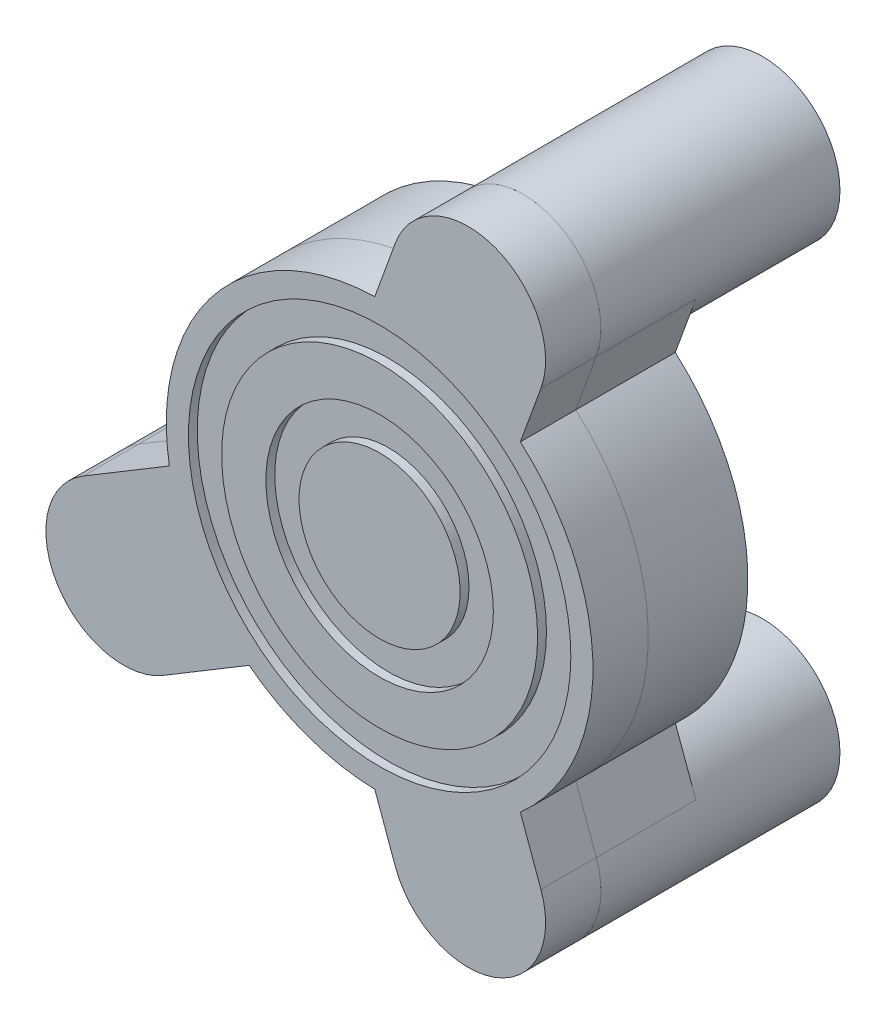
from build123d import *

# Parameters (mm, degrees)
SKETCH1_R             = 9.639410298
SKETCH1_W             = 11
SKETCH1_H             = 12
BOSS_EXTRUDE1_DEPTH   = 2.5
BOSS_EXTRUDE2_START   = 2
SKETCH2_R             = 9.639410298
SKETCH2_W             = 11
SKETCH2_H             = 12
SKETCH2_W_2           = 2.7
SKETCH2_H_2           = 11
BOSS_EXTRUDE2_DEPTH   = 2
SKETCH3_R             = 1
BOSS_EXTRUDE3_DEPTH   = 4.5
SKETCH4_R             = 1
BOSS_EXTRUDE4_DEPTH   = 6.3
SKETCH5_W             = 4
SKETCH5_H             = 2
BOSS_EXTRUDE5_DEPTH   = 1.5
FILLET1_R             = 1.5
SKETCH6_R             = 2.05
CUT_EXTRUDE1_DEPTH    = 6.8
SKETCH7_R             = 1
BOSS_EXTRUDE6_DEPTH   = 0.2
CUT_EXTRUDE2_DEPTH    = 1
FILLET2_R             = 1
FILLET3_R             = 1
SKETCH9_R             = 2.05
BOSS_EXTRUDE7_DEPTH   = 1.5
BOSS_EXTRUDE8_START   = 1
BOSS_EXTRUDE8_DEPTH   = 1
SKETCH11_R            = 1.8
BOSS_EXTRUDE9_DEPTH   = 2
BOSS_EXTRUDE9_2_DEPTH = 2
BOSS_EXTRUDE9_3_DEPTH = 2
CHAMFER1_SIZE         = 0.8
SKETCH12_R            = 8.639410298
SKETCH12_R_2          = 7.139410298
SKETCH12_R_3          = 5.139410298
SKETCH12_R_4          = 3.639410298
CUT_EXTRUDE3_DEPTH    = 0.4


with BuildPart() as part:
    # Sketch1 → Boss-Extrude1 (new body)
    with BuildSketch(Plane.XY):
        Circle(SKETCH1_R)
        Rectangle(SKETCH1_W, SKETCH1_H, mode=Mode.SUBTRACT)
    extrude(amount=-BOSS_EXTRUDE1_DEPTH)

    # Sketch2 → Boss-Extrude2 (add)
    # profile 1 of 2: a face of its own
    with BuildSketch(Plane.XY.offset(BOSS_EXTRUDE2_START)):
        Circle(SKETCH2_R)
        Rectangle(SKETCH2_W, SKETCH2_H, mode=Mode.SUBTRACT)
    # profile 2 of 2: a face of its own
    with BuildSketch(Plane.XY.offset(BOSS_EXTRUDE2_START)):
        Rectangle(SKETCH2_W, SKETCH2_H)
        with Locations((3.81, 0)):
            Rectangle(SKETCH2_W_2, SKETCH2_H_2, mode=Mode.SUBTRACT)
        with Locations((-3.81, 0)):
            Rectangle(SKETCH2_W_2, SKETCH2_H_2, mode=Mode.SUBTRACT)
    extrude(amount=-BOSS_EXTRUDE2_DEPTH)

    # Sketch3 → Boss-Extrude3 (add)
    # profile 1 of 3: a face of its own
    with BuildSketch(Plane.XY.offset(2)):
        with BuildLine():
            Line((-9.501068119, -1.627247829), (-13.381703586, -3.959799129))
            ThreePointArc((-13.381703586, -3.959799129), (-14.578400953, -8.762706104), (-9.775493977, -9.959403471))
            Line((-9.775493977, -9.959403471), (-5.89485851, -7.626852171))
            ThreePointArc((-5.89485851, -7.626852171), (-8.26180684, -4.965962005), (-9.501068119, -1.627247829))
        make_face()
        with Locations((-11.578598782, -6.9596013)):
            Circle(SKETCH3_R, mode=Mode.SUBTRACT)
    # profile 2 of 3: a face of its own
    with BuildSketch(Plane.XY.offset(2)):
        with BuildLine():
            Line((0.710723018, 12.196100721), (-0.219894755, 9.636901846))
            ThreePointArc((-0.219894755, 9.636901846), (3.294201602, 9.059054404), (6.35865921, 7.244700404))
            Line((6.35865921, 7.244700404), (7.289276982, 9.803899279))
            ThreePointArc((7.289276982, 9.803899279), (5.196100721, 14.289276982), (0.710723018, 12.196100721))
        make_face()
        with Locations((4, 11)):
            Circle(SKETCH3_R, mode=Mode.SUBTRACT)
    # profile 3 of 3: a face of its own
    with BuildSketch(Plane.XY.offset(2)):
        with BuildLine():
            Line((-0.219894755, -9.636901846), (0.710723018, -12.196100721))
            ThreePointArc((0.710723018, -12.196100721), (5.196100721, -14.289276982), (7.289276982, -9.803899279))
            Line((7.289276982, -9.803899279), (6.35865921, -7.244700404))
            ThreePointArc((6.35865921, -7.244700404), (3.294201602, -9.059054404), (-0.219894755, -9.636901846))
        make_face()
        with Locations((4, -11)):
            Circle(SKETCH3_R, mode=Mode.SUBTRACT)
    extrude(amount=-BOSS_EXTRUDE3_DEPTH)

    # Sketch4 → Boss-Extrude4 (add)
    # profile 1 of 3: a face of its own
    with BuildSketch(Plane(origin=(0, 0, -2.5), x_dir=(-1, 0, 0), z_dir=(0, 0, -1))):
        with BuildLine():
            ThreePointArc((13.381703586, -3.959799129), (8.578796611, -5.156496496), (9.775493977, -9.959403471))
            ThreePointArc((9.775493977, -9.959403471), (13.301841827, -10.005981678), (15.078598782, -6.9596013))
            ThreePointArc((15.078598782, -6.9596013), (14.62497916, -5.236358255), (13.381703586, -3.959799129))
        make_face()
        with Locations(Location((11.578598782, -6.9596013, 0), (0, 0, 180))):
            Circle(SKETCH4_R, mode=Mode.SUBTRACT)
    # profile 2 of 3: a face of its own
    with BuildSketch(Plane(origin=(0, 0, -2.5), x_dir=(-1, 0, 0), z_dir=(0, 0, -1))):
        with BuildLine():
            ThreePointArc((-7.289276982, -9.803899279), (-5.196100721, -14.289276982), (-0.710723018, -12.196100721))
            ThreePointArc((-0.710723018, -12.196100721), (-0.553083303, -11.607260472), (-0.5, -11))
            ThreePointArc((-0.5, -11), (-3.392739528, -7.553083303), (-7.289276982, -9.803899279))
        make_face()
        with Locations(Location((-4, -11, 0), (0, 0, 180))):
            Circle(SKETCH4_R, mode=Mode.SUBTRACT)
    # profile 3 of 3: a face of its own
    with BuildSketch(Plane(origin=(0, 0, -2.5), x_dir=(-1, 0, 0), z_dir=(0, 0, -1))):
        with BuildLine():
            ThreePointArc((-0.5, 11), (-0.553083303, 11.607260472), (-0.710723018, 12.196100721))
            ThreePointArc((-0.710723018, 12.196100721), (-5.196100721, 14.289276982), (-7.289276982, 9.803899279))
            ThreePointArc((-7.289276982, 9.803899279), (-3.392739528, 7.553083303), (-0.5, 11))
        make_face()
        with Locations(Location((-4, 11, 0), (0, 0, 180))):
            Circle(SKETCH4_R, mode=Mode.SUBTRACT)
    extrude(amount=BOSS_EXTRUDE4_DEPTH)

    # Sketch5 → Boss-Extrude5 (add)
    with BuildSketch(Plane(origin=(0, 0, -2.5), x_dir=(-1, 0, 0), z_dir=(0, 0, -1))):
        with Locations((0, -7)):
            Rectangle(SKETCH5_W, SKETCH5_H)
        with Locations((0, 7)):
            Rectangle(SKETCH5_W, SKETCH5_H)
    extrude(amount=BOSS_EXTRUDE5_DEPTH)

    # Fillet1
    fillet1_edges = [part.edges().sort_by_distance(p)[0] for p in [
        (0, 8, -4),
        (0, -8, -4),
        (2, -7, -4),
        (-2, -7, -4),
        (-2, 7, -4),
        (2, 7, -4),
    ]]
    fillet(fillet1_edges, radius=FILLET1_R - 0.0001)  # a hair under: the kernel refuses the full size

    # Sketch6 → Cut-Extrude1 (cut)
    with BuildSketch(Plane.XY.offset(2)):
        with Locations((4, 11)):
            Circle(SKETCH6_R)
        with Locations((-11.578598782, -6.9596013)):
            Circle(SKETCH6_R)
        with Locations((4, -11)):
            Circle(SKETCH6_R)
    extrude(amount=-CUT_EXTRUDE1_DEPTH, mode=Mode.SUBTRACT)

    # Sketch7 → Boss-Extrude6 (add)
    with BuildSketch(Plane.XY.offset(-4.8)):
        with Locations((-11.578598782, -6.9596013)):
            Circle(SKETCH7_R)
        with Locations((4, 11)):
            Circle(SKETCH7_R)
        with Locations((4, -11)):
            Circle(SKETCH7_R)
    extrude(amount=-BOSS_EXTRUDE6_DEPTH)

    # Sketch8 → Cut-Extrude2 (cut)
    with BuildSketch(Plane.XY.offset(2)):
        with BuildLine():
            Line((-2.46, 5.5), (0, 0))
            Line((0, 0), (2.46, 5.5))
            Line((2.46, 5.5), (2.46, -5.5))
            Line((2.46, -5.5), (-0.219894755, -9.636901846))
            ThreePointArc((-0.219894755, -9.636901846), (-2.391673729, -9.337993771), (-4.439749185, -8.556100634))
            Line((-4.439749185, -8.556100634), (-2.46, -5.5))
            Line((-2.46, -5.5), (-2.46, 5.5))
        make_face()
    extrude(amount=-CUT_EXTRUDE2_DEPTH, mode=Mode.SUBTRACT)

    # Fillet2
    fillet2_edges = [part.edges().sort_by_distance(p)[0] for p in [
        (0, 0, 1.5),
        (-2.46, -5.5, 1.5),
        (2.46, -5.5, 1.5),
    ]]
    fillet(fillet2_edges, radius=FILLET2_R)

    # Fillet3
    fillet3_edges = [part.edges().sort_by_distance(p)[0] for p in [
        (-2.391673729, -9.337993771, 1),
    ]]
    fillet(fillet3_edges, radius=FILLET3_R)


with BuildPart() as body_2:
    # Sketch9 → Boss-Extrude7 (new body)
    # profile 1 of 13: a face of its own
    with BuildSketch(Plane.XY.offset(2)):
        with BuildLine():
            ThreePointArc((0.813420314, 9.552343307), (2.803899279, 7.710723018), (5.512387431, 7.843627991))
            Line((5.512387431, 7.843627991), (6.349483559, 10.145642342))
            ThreePointArc((6.349483559, 10.145642342), (4.854357658, 13.349483559), (1.650516441, 11.854357658))
            Line((1.650516441, 11.854357658), (0.813420314, 9.552343307))
        make_face()
        with Locations((4, 11)):
            Circle(SKETCH9_R, mode=Mode.SUBTRACT)
    # profile 2 of 13: a face of its own
    with BuildSketch(Plane.XY.offset(2)):
        with BuildLine():
            Line((6.349483559, 10.145642342), (5.512387431, 7.843627991))
            ThreePointArc((5.512387431, 7.843627991), (6.593195165, 8.64939607), (7.289276982, 9.803899279))
            ThreePointArc((7.289276982, 9.803899279), (7.446916697, 10.392739528), (7.5, 11))
            ThreePointArc((7.5, 11), (4.607260472, 14.446916697), (0.710723018, 12.196100721))
            ThreePointArc((0.710723018, 12.196100721), (0.502637678, 10.864144248), (0.813420314, 9.552343307))
            Line((0.813420314, 9.552343307), (1.650516441, 11.854357658))
            ThreePointArc((1.650516441, 11.854357658), (4.854357658, 13.349483559), (6.349483559, 10.145642342))
        make_face()
    # profile 3 of 13: a face of its own
    with BuildSketch(Plane.XY.offset(2)):
        with BuildLine():
            Line((-12.866530785, -4.816885464), (-10.767106599, -3.554974971))
            ThreePointArc((-10.767106599, -3.554974971), (-12.114130805, -3.500814598), (-13.381703586, -3.959799129))
            ThreePointArc((-13.381703586, -3.959799129), (-14.578400953, -8.762706104), (-9.775493977, -9.959403471))
            ThreePointArc((-9.775493977, -9.959403471), (-8.775429465, -9.055368888), (-8.191242593, -7.840406644))
            Line((-8.191242593, -7.840406644), (-10.290666779, -9.102317136))
            ThreePointArc((-10.290666779, -9.102317136), (-13.721314618, -8.247533303), (-12.866530785, -4.816885464))
        make_face()
    # profile 4 of 13: a face of its own
    with BuildSketch(Plane.XY.offset(2)):
        with BuildLine():
            ThreePointArc((-8.078598782, -6.9596013), (-8.831762179, -4.790525764), (-10.767106599, -3.554974971))
            Line((-10.767106599, -3.554974971), (-12.866530785, -4.816885464))
            ThreePointArc((-12.866530785, -4.816885464), (-13.721314618, -8.247533303), (-10.290666779, -9.102317136))
            Line((-10.290666779, -9.102317136), (-8.191242593, -7.840406644))
            ThreePointArc((-8.191242593, -7.840406644), (-8.106873947, -7.403590794), (-8.078598782, -6.9596013))
        make_face()
        with Locations((-11.578598782, -6.9596013)):
            Circle(SKETCH9_R, mode=Mode.SUBTRACT)
    # profile 5 of 13: a face of its own
    with BuildSketch(Plane.XY.offset(2)):
        with BuildLine():
            Line((0.476659469, 8.626250985), (0.813420314, 9.552343307))
            ThreePointArc((0.813420314, 9.552343307), (0.502637678, 10.864144248), (0.710723018, 12.196100721))
            Line((0.710723018, 12.196100721), (-0.219894755, 9.636901846))
            ThreePointArc((-0.219894755, 9.636901846), (-7.439391559, 6.129737688), (-9.501068119, -1.627247829))
            Line((-9.501068119, -1.627247829), (-13.381703586, -3.959799129))
            ThreePointArc((-13.381703586, -3.959799129), (-12.114130805, -3.500814598), (-10.767106599, -3.554974971))
            Line((-10.767106599, -3.554974971), (-8.375855155, -2.117654534))
            ThreePointArc((-8.375855155, -2.117654534), (-6.667623232, 5.493833883), (0.476659469, 8.626250985))
        make_face()
    # profile 6 of 13: a face of its own
    with BuildSketch(Plane.XY.offset(2)):
        with BuildLine():
            Line((-6.410031312, -6.769765836), (-8.191242593, -7.840406644))
            ThreePointArc((-8.191242593, -7.840406644), (-8.775429465, -9.055368888), (-9.775493977, -9.959403471))
            Line((-9.775493977, -9.959403471), (-5.89485851, -7.626852171))
            Line((-5.89485851, -7.626852171), (-6.410031312, -6.769765836))
        make_face()
    # profile 7 of 13: a face of its own
    with BuildSketch(Plane.XY.offset(2)):
        with BuildLine():
            Line((0.813420314, -9.552343307), (0.719898669, -9.295158783))
            Line((0.719898669, -9.295158783), (-0.219894755, -9.636901846))
            Line((-0.219894755, -9.636901846), (0.710723018, -12.196100721))
            ThreePointArc((0.710723018, -12.196100721), (0.502637678, -10.864144248), (0.813420314, -9.552343307))
        make_face()
    # profile 8 of 13: a face of its own
    with BuildSketch(Plane.XY.offset(2)):
        with BuildLine():
            Line((1.650516441, -11.854357658), (0.813420314, -9.552343307))
            ThreePointArc((0.813420314, -9.552343307), (0.502637678, -10.864144248), (0.710723018, -12.196100721))
            ThreePointArc((0.710723018, -12.196100721), (4.607260472, -14.446916697), (7.5, -11))
            ThreePointArc((7.5, -11), (7.446916697, -10.392739528), (7.289276982, -9.803899279))
            ThreePointArc((7.289276982, -9.803899279), (6.593195165, -8.64939607), (5.512387431, -7.843627991))
            Line((5.512387431, -7.843627991), (6.349483559, -10.145642342))
            ThreePointArc((6.349483559, -10.145642342), (4.854357658, -13.349483559), (1.650516441, -11.854357658))
        make_face()
    # profile 9 of 13: a face of its own
    with BuildSketch(Plane.XY.offset(2)):
        with BuildLine():
            ThreePointArc((5.512387431, -7.843627991), (2.803899279, -7.710723018), (0.813420314, -9.552343307))
            Line((0.813420314, -9.552343307), (1.650516441, -11.854357658))
            ThreePointArc((1.650516441, -11.854357658), (4.854357658, -13.349483559), (6.349483559, -10.145642342))
            Line((6.349483559, -10.145642342), (5.512387431, -7.843627991))
        make_face()
        with Locations((4, -11)):
            Circle(SKETCH9_R, mode=Mode.SUBTRACT)
    # profile 10 of 13: a face of its own
    with BuildSketch(Plane.XY.offset(2)):
        with BuildLine():
            Line((5.175626587, -6.917535669), (5.512387431, -7.843627991))
            ThreePointArc((5.512387431, -7.843627991), (6.593195165, -8.64939607), (7.289276982, -9.803899279))
            Line((7.289276982, -9.803899279), (6.35865921, -7.244700404))
            ThreePointArc((6.35865921, -7.244700404), (9.639410298, 0), (6.35865921, 7.244700404))
            Line((6.35865921, 7.244700404), (7.289276982, 9.803899279))
            ThreePointArc((7.289276982, 9.803899279), (6.593195165, 8.64939607), (5.512387431, 7.843627991))
            Line((5.512387431, 7.843627991), (5.175626587, 6.917535669))
            ThreePointArc((5.175626587, 6.917535669), (8.639410298, 0), (5.175626587, -6.917535669))
        make_face()
    # profile 11 of 13: a face of its own
    with BuildSketch(Plane.XY.offset(2)):
        with Locations((-11.578598782, -6.9596013)):
            Circle(SKETCH9_R)
    # profile 12 of 13: a face of its own
    with BuildSketch(Plane.XY.offset(2)):
        with Locations((4, 11)):
            Circle(SKETCH9_R)
    # profile 13 of 13: a face of its own
    with BuildSketch(Plane.XY.offset(2)):
        with Locations((4, -11)):
            Circle(SKETCH9_R)
    extrude(amount=BOSS_EXTRUDE7_DEPTH)

    # Sketch10 → Boss-Extrude8 (add)
    with BuildSketch(Plane.XY.offset(3.5).offset(BOSS_EXTRUDE8_START)):
        with BuildLine():
            ThreePointArc((-5.89485851, -7.626852171), (-3.218326708, -9.086286596), (-0.219894755, -9.636901846))
            Line((-0.219894755, -9.636901846), (0.719898669, -9.295158783))
            Line((0.719898669, -9.295158783), (0.813420314, -9.552343307))
            ThreePointArc((0.813420314, -9.552343307), (2.803899279, -7.710723018), (5.512387431, -7.843627991))
            Line((5.512387431, -7.843627991), (5.175626587, -6.917535669))
            ThreePointArc((5.175626587, -6.917535669), (8.639410298, 0), (5.175626587, 6.917535669))
            Line((5.175626587, 6.917535669), (5.512387431, 7.843627991))
            ThreePointArc((5.512387431, 7.843627991), (2.803899279, 7.710723018), (0.813420314, 9.552343307))
            Line((0.813420314, 9.552343307), (0.476659469, 8.626250985))
            ThreePointArc((0.476659469, 8.626250985), (-6.667623232, 5.493833883), (-8.375855155, -2.117654534))
            Line((-8.375855155, -2.117654534), (-10.767106599, -3.554974971))
            ThreePointArc((-10.767106599, -3.554974971), (-8.578796611, -5.156496496), (-8.191242593, -7.840406644))
            Line((-8.191242593, -7.840406644), (-6.410031312, -6.769765836))
            Line((-6.410031312, -6.769765836), (-5.89485851, -7.626852171))
        make_face()
        with BuildLine():
            Line((-9.501068119, -1.627247829), (-13.381703586, -3.959799129))
            ThreePointArc((-13.381703586, -3.959799129), (-14.578400953, -8.762706104), (-9.775493977, -9.959403471))
            Line((-9.775493977, -9.959403471), (-5.89485851, -7.626852171))
            Line((-5.89485851, -7.626852171), (-6.410031312, -6.769765836))
            Line((-6.410031312, -6.769765836), (-8.191242593, -7.840406644))
            ThreePointArc((-8.191242593, -7.840406644), (-8.578796611, -5.156496496), (-10.767106599, -3.554974971))
            Line((-10.767106599, -3.554974971), (-8.375855155, -2.117654534))
            ThreePointArc((-8.375855155, -2.117654534), (-6.667623232, 5.493833883), (0.476659469, 8.626250985))
            Line((0.476659469, 8.626250985), (0.813420314, 9.552343307))
            ThreePointArc((0.813420314, 9.552343307), (2.803899279, 7.710723018), (5.512387431, 7.843627991))
            Line((5.512387431, 7.843627991), (5.175626587, 6.917535669))
            ThreePointArc((5.175626587, 6.917535669), (8.639410298, 0), (5.175626587, -6.917535669))
            Line((5.175626587, -6.917535669), (5.512387431, -7.843627991))
            ThreePointArc((5.512387431, -7.843627991), (2.803899279, -7.710723018), (0.813420314, -9.552343307))
            Line((0.813420314, -9.552343307), (0.719898669, -9.295158783))
            Line((0.719898669, -9.295158783), (-0.219894755, -9.636901846))
            Line((-0.219894755, -9.636901846), (0.710723018, -12.196100721))
            ThreePointArc((0.710723018, -12.196100721), (5.196100721, -14.289276982), (7.289276982, -9.803899279))
            Line((7.289276982, -9.803899279), (6.35865921, -7.244700404))
            ThreePointArc((6.35865921, -7.244700404), (9.639410298, 0), (6.35865921, 7.244700404))
            Line((6.35865921, 7.244700404), (7.289276982, 9.803899279))
            ThreePointArc((7.289276982, 9.803899279), (5.196100721, 14.289276982), (0.710723018, 12.196100721))
            Line((0.710723018, 12.196100721), (-0.219894755, 9.636901846))
            ThreePointArc((-0.219894755, 9.636901846), (-7.439391559, 6.129737688), (-9.501068119, -1.627247829))
        make_face()
    extrude(amount=-BOSS_EXTRUDE8_DEPTH)


with BuildPart() as body_3:
    # Sketch11 → Boss-Extrude9 (new body)
    with BuildSketch(Plane(origin=(0, 0, 2), x_dir=(-1, 0, 0), z_dir=(0, 0, -1))):
        with Locations((-4, 11)):
            Circle(SKETCH11_R)
    extrude(amount=BOSS_EXTRUDE9_DEPTH)


with BuildPart() as body_4:
    # Sketch11 → Boss-Extrude9 2 (new body)
    with BuildSketch(Plane(origin=(0, 0, 2), x_dir=(-1, 0, 0), z_dir=(0, 0, -1))):
        with Locations((11.578598782, -6.9596013)):
            Circle(SKETCH11_R)
    extrude(amount=BOSS_EXTRUDE9_2_DEPTH)


with BuildPart() as body_5:
    # Sketch11 → Boss-Extrude9 3 (new body)
    with BuildSketch(Plane(origin=(0, 0, 2), x_dir=(-1, 0, 0), z_dir=(0, 0, -1))):
        with Locations((-4, -11)):
            Circle(SKETCH11_R)
    extrude(amount=BOSS_EXTRUDE9_3_DEPTH)


with BuildPart() as body_2_1:
    add(body_2.part)

    # Combine1: union body 4, body 3, body 5
    add(body_4.part)
    add(body_3.part)
    add(body_5.part)

    # Chamfer1
    chamfer1_edges = [body_2_1.edges().sort_by_distance(p)[0] for p in [
        (-9.778598782, -6.9596013, 0),
        (5.8, 11, 0),
        (5.8, -11, 0),
    ]]
    chamfer(chamfer1_edges, length=CHAMFER1_SIZE)

    # Sketch12 → Cut-Extrude3 (cut)
    # profile 1 of 2: a face of its own
    with BuildSketch(Plane.XY.offset(4.5)):
        Circle(SKETCH12_R)
        Circle(SKETCH12_R_2, mode=Mode.SUBTRACT)
    # profile 2 of 2: a face of its own
    with BuildSketch(Plane.XY.offset(4.5)):
        Circle(SKETCH12_R_3)
        Circle(SKETCH12_R_4, mode=Mode.SUBTRACT)
    extrude(amount=-CUT_EXTRUDE3_DEPTH, mode=Mode.SUBTRACT)


solid = Compound([part.part, body_2_1.part])
